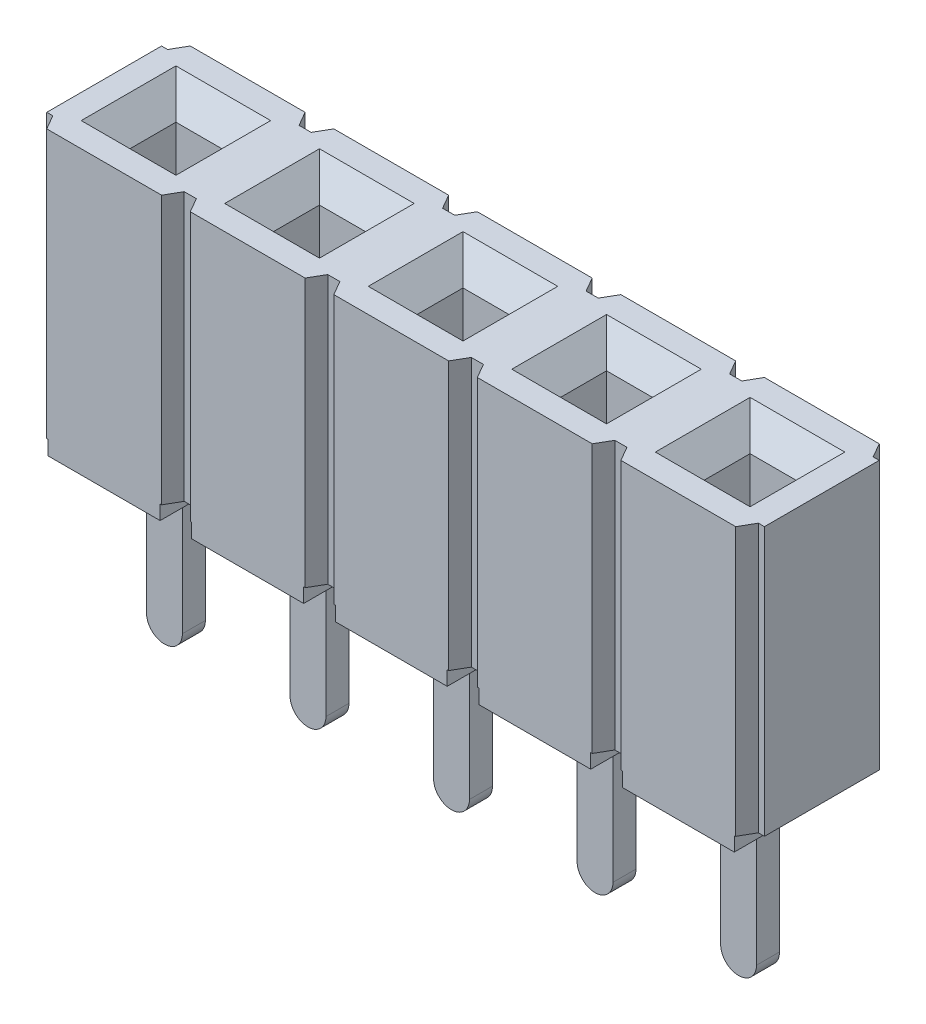
from build123d import *

# Parameters (mm, degrees)
SKETCH1_W                      = 40.64
SKETCH1_H                      = 2.54
BASE_EXTRUDE_DEPTH             = 5
SKETCH2_W                      = 1.524
SKETCH2_H                      = 0.254
STANDOFF_WIDTH_DEPTH           = 41.966114046
UPPER_START                    = -19.4945
UPPER_CORE_OUTLINE_W           = 3.3528
UPPER_CORE_OUTLINE_H           = 0.889
UPPER_CORE_DEPTH               = 0.889
LEAD_IN_SIZE                   = 0.3937
LEAD_IN_SIZE2                  = 0.469193389
CORE_PATTERN_COUNT             = 16
CORE_PATTERN_PITCH             = 2.54
LEAD_IN_OF_CORE_PATTERN_SIZE2  = 0.469193389
LEAD_IN_OF_CORE_PATTERN_SIZE   = 0.3937
POSITION_CUT_DEPTH             = 21.964620197
SKETCH10_W                     = 0.2794
SKETCH10_H                     = 0.254
STANDOFF_LENGTH_DEPTH          = 22.07970588
STANDOFF_PATTERN_COUNT         = 16
STANDOFF_PATTERN_PITCH         = 2.54
SKETCH11_W                     = 0.635
SKETCH11_H                     = 0.4064
TAIL_DEPTH                     = 3.175
TAIL_FILLETS_R                 = 0.3175
TAIL_PATTERN_COUNT             = 16
TAIL_PATTERN_PITCH             = 2.54
TAIL_FILLETS_OF_TAIL_PATTERN_R = 0.3175
SKETCH12_W                     = 27.94
SKETCH12_H                     = 7.921
CUT_EXTRUDE1_DEPTH             = 22.07970588


# Read off the part's stored shape, not the designer's step: Upper Core
with BuildPart() as part:
    # Sketch1 → Base-Extrude (new body)
    with BuildSketch(Plane(origin=(0, 0, 0), x_dir=(1, 0, 0), z_dir=(0, 1, 0))):
        Rectangle(SKETCH1_W, SKETCH1_H)
    extrude(amount=BASE_EXTRUDE_DEPTH)

    # Sketch2 → Standoff - Width (cut, through all)
    with BuildSketch(Plane.ZY.offset(20.32)):
        with Locations((0, 0.127)):
            Rectangle(SKETCH2_W, SKETCH2_H)
    extrude(amount=-STANDOFF_WIDTH_DEPTH, mode=Mode.SUBTRACT)

    # Upper Core outline → Upper Core (cut)
    with BuildSketch(Plane.YZ.offset(UPPER_START)):
        with Locations((3.3236, 0)):
            Rectangle(UPPER_CORE_OUTLINE_W, UPPER_CORE_OUTLINE_H)
    upper_core = extrude(amount=UPPER_CORE_DEPTH, mode=Mode.SUBTRACT)

    # Lead-in
    lead_in_edges = [part.edges().sort_by_distance(p)[0] for p in [
        (-19.4945, 5, 0),
        (-19.05, 5, 0.4445),
        (-18.6055, 5, 0),
        (-19.05, 5, -0.4445),
    ]]
    lead_in_side = [part.faces().sort_by_distance(p)[0] for p in [
        (0.146976854, 5, 0),
    ]]
    chamfer(lead_in_edges, length=LEAD_IN_SIZE, length2=LEAD_IN_SIZE2, reference=lead_in_side[0])

    # Core Pattern: Upper Core ×16
    with Locations(*[(i * CORE_PATTERN_PITCH, 0, 0) for i in range(1, CORE_PATTERN_COUNT)]):
        add(upper_core, mode=Mode.SUBTRACT)

    # Lead-in of Core Pattern
    lead_in_of_core_pattern_edges = [part.edges().sort_by_distance(p)[0] for p in [
        (-16.9545, 5, 0),
        (-16.51, 5, 0.4445),
        (-16.0655, 5, 0),
        (-16.51, 5, -0.4445),
        (-14.4145, 5, 0),
        (-13.97, 5, 0.4445),
        (-13.5255, 5, 0),
        (-13.97, 5, -0.4445),
        (-11.8745, 5, 0),
        (-11.43, 5, 0.4445),
        (-10.9855, 5, 0),
        (-11.43, 5, -0.4445),
        (-9.3345, 5, 0),
        (-8.89, 5, 0.4445),
        (-8.4455, 5, 0),
        (-8.89, 5, -0.4445),
        (-6.7945, 5, 0),
        (-6.35, 5, 0.4445),
        (-5.9055, 5, 0),
        (-6.35, 5, -0.4445),
        (-4.2545, 5, 0),
        (-3.81, 5, 0.4445),
        (-3.3655, 5, 0),
        (-3.81, 5, -0.4445),
        (-1.7145, 5, 0),
        (-1.27, 5, 0.4445),
        (-0.8255, 5, 0),
        (-1.27, 5, -0.4445),
        (0.8255, 5, 0),
        (1.27, 5, 0.4445),
        (1.7145, 5, 0),
        (1.27, 5, -0.4445),
        (3.3655, 5, 0),
        (3.81, 5, 0.4445),
        (4.2545, 5, 0),
        (3.81, 5, -0.4445),
        (5.9055, 5, 0),
        (6.35, 5, 0.4445),
        (6.7945, 5, 0),
        (6.35, 5, -0.4445),
        (8.4455, 5, 0),
        (8.89, 5, 0.4445),
        (9.3345, 5, 0),
        (8.89, 5, -0.4445),
        (10.9855, 5, 0),
        (11.43, 5, 0.4445),
        (11.8745, 5, 0),
        (11.43, 5, -0.4445),
        (13.5255, 5, 0),
        (13.97, 5, 0.4445),
        (14.4145, 5, 0),
        (13.97, 5, -0.4445),
        (16.0655, 5, 0),
        (16.51, 5, 0.4445),
        (16.9545, 5, 0),
        (16.51, 5, -0.4445),
        (18.6055, 5, 0),
        (19.05, 5, 0.4445),
        (19.4945, 5, 0),
        (19.05, 5, -0.4445),
    ]]
    chamfer(lead_in_of_core_pattern_edges, length=LEAD_IN_OF_CORE_PATTERN_SIZE, length2=LEAD_IN_OF_CORE_PATTERN_SIZE2)

    # Sketch4 → Position Cut (cut, through all)
    with BuildSketch(Plane(origin=(0, 5, 0), x_dir=(-1, 0, 0), z_dir=(0, 1, 0))):
        Polygon((20.32, 1.016), (20.212646968, 1.016), (20.066, 1.27), (20.32, 1.27), align=None)
        Polygon((20.066, -1.27), (20.32, -1.27), (20.32, -1.016), (20.212646968, -1.016), align=None)
        Polygon((17.78, -1.016), (17.887353032, -1.016), (18.034, -1.27), (17.78, -1.27), align=None)
        Polygon((18.034, 1.27), (17.78, 1.27), (17.78, 1.016), (17.887353032, 1.016), align=None)
    position_cut = extrude(amount=-POSITION_CUT_DEPTH, mode=Mode.SUBTRACT)

    # Sketch10 → Standoff - Length (cut, through all)
    with BuildSketch(Plane.XY.offset(1.27)):
        with Locations((-17.9197, 0.127)):
            Rectangle(SKETCH10_W, SKETCH10_H)
        with Locations((-20.1803, 0.127)):
            Rectangle(SKETCH10_W, SKETCH10_H)
    standoff_length = extrude(amount=-STANDOFF_LENGTH_DEPTH, mode=Mode.SUBTRACT)

    # Standoff Pattern: Position Cut, Standoff - Length ×16
    with Locations(*[(i * STANDOFF_PATTERN_PITCH, 0, 0) for i in range(1, STANDOFF_PATTERN_COUNT)]):
        add(position_cut, mode=Mode.SUBTRACT)
        add(standoff_length, mode=Mode.SUBTRACT)

    # Sketch11 → Tail (add)
    with BuildSketch(Plane.XZ.offset(-0.254)):
        with Locations((-19.05, 0)):
            Rectangle(SKETCH11_W, SKETCH11_H)
    tail = extrude(amount=TAIL_DEPTH)

    # Tail Fillets
    tail_fillets_edges = [part.edges().sort_by_distance(p)[0] for p in [
        (-19.3675, -2.921, 0),
        (-18.7325, -2.921, 0),
    ]]
    fillet(tail_fillets_edges, radius=TAIL_FILLETS_R - 0.0001)  # a hair under: the kernel refuses the full size

    # Tail Pattern: Tail ×16
    with Locations(*[(i * TAIL_PATTERN_PITCH, 0, 0) for i in range(1, TAIL_PATTERN_COUNT)]):
        add(tail)

    # Tail Fillets of Tail Pattern
    tail_fillets_of_tail_pattern_edges = [part.edges().sort_by_distance(p)[0] for p in [
        (-16.8275, -2.921, 0),
        (-16.1925, -2.921, 0),
        (-14.2875, -2.921, 0),
        (-13.6525, -2.921, 0),
        (-11.7475, -2.921, 0),
        (-11.1125, -2.921, 0),
        (-9.2075, -2.921, 0),
        (-8.5725, -2.921, 0),
        (-6.6675, -2.921, 0),
        (-6.0325, -2.921, 0),
        (-4.1275, -2.921, 0),
        (-3.4925, -2.921, 0),
        (-1.5875, -2.921, 0),
        (-0.9525, -2.921, 0),
        (0.9525, -2.921, 0),
        (1.5875, -2.921, 0),
        (3.4925, -2.921, 0),
        (4.1275, -2.921, 0),
        (6.0325, -2.921, 0),
        (6.6675, -2.921, 0),
        (8.5725, -2.921, 0),
        (9.2075, -2.921, 0),
        (11.1125, -2.921, 0),
        (11.7475, -2.921, 0),
        (13.6525, -2.921, 0),
        (14.2875, -2.921, 0),
        (16.1925, -2.921, 0),
        (16.8275, -2.921, 0),
        (18.7325, -2.921, 0),
        (19.3675, -2.921, 0),
    ]]
    fillet(tail_fillets_of_tail_pattern_edges, radius=TAIL_FILLETS_OF_TAIL_PATTERN_R - 0.0001)  # a hair under: the kernel refuses the full size

    # Sketch12 → Cut-Extrude1 (cut, through all)
    with BuildSketch(Plane.XY.offset(1.27)):
        with Locations((6.35, 1.0395)):
            Rectangle(SKETCH12_W, SKETCH12_H)
    extrude(amount=-CUT_EXTRUDE1_DEPTH, mode=Mode.SUBTRACT)


solid = part.part
